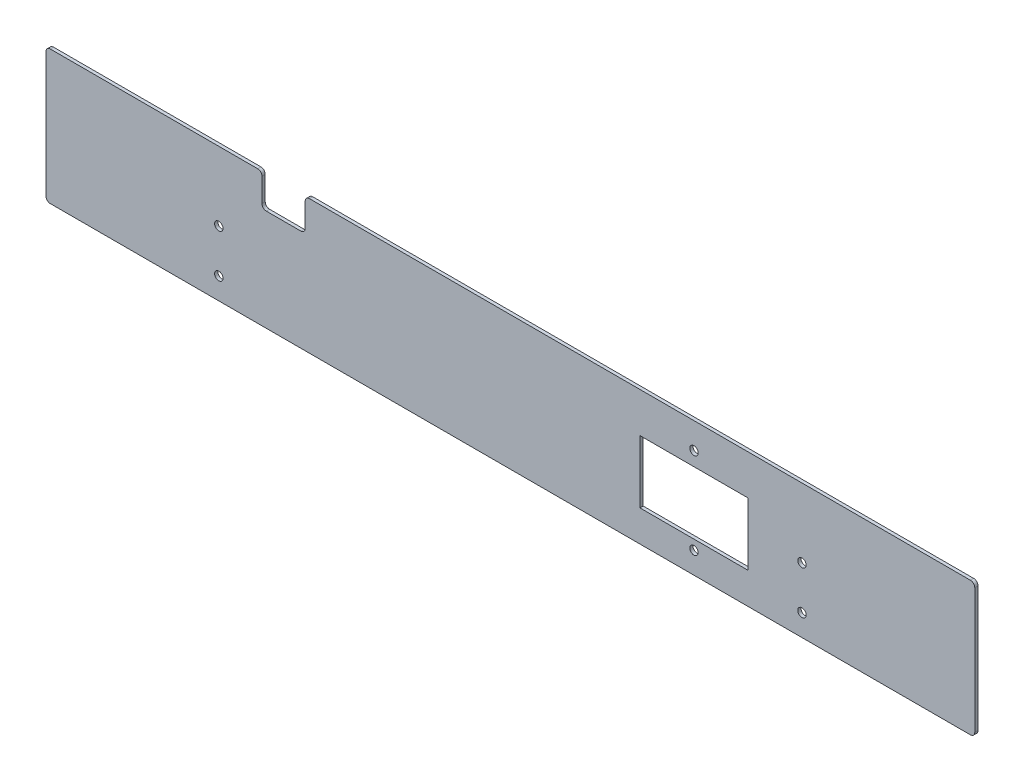
from build123d import *

# Parameters (mm, degrees)
SKETCH1_R           = 1.95
SKETCH1_W           = 50
SKETCH1_H           = 29
BOSS_EXTRUDE1_DEPTH = 1.5
FILLET1_R           = 2
SKETCH3_R           = 1.95
CUT_EXTRUDE1_DEPTH  = 10


with BuildPart() as part:
    # Sketch1 → Boss-Extrude1 (new body)
    with BuildSketch(Plane.XY):
        Polygon((-234.424811832, 29.703517588), (75.575188168, 29.703517588), (75.575188168, -32.296482412), (-354.424811832, -32.296482412), (-354.424811832, 29.703517588), (-254.424811832, 29.703517588), (-254.424811832, 14.703517588), (-234.424811832, 14.703517588), align=None)
        with Locations((-54.424811832, 17.703517588)):
            Circle(SKETCH1_R, mode=Mode.SUBTRACT)
        with Locations((-54.424811832, -22.296482412)):
            Circle(SKETCH1_R, mode=Mode.SUBTRACT)
        with Locations((-54.424811832, -3.296482412)):
            Rectangle(SKETCH1_W, SKETCH1_H, mode=Mode.SUBTRACT)
    extrude(amount=BOSS_EXTRUDE1_DEPTH)

    # Fillet1
    fillet1_edges = [part.edges().sort_by_distance(p)[0] for p in [
        (75.575188168, -32.296482412, 0.75),
        (-354.424811832, -32.296482412, 0.75),
        (-354.424811832, 29.703517588, 0.75),
        (-234.424811832, 14.703517588, 0.75),
        (-254.424811832, 14.703517588, 0.75),
        (-254.424811832, 29.703517588, 0.75),
        (-234.424811832, 29.703517588, 0.75),
        (75.575188168, 29.703517588, 0.75),
    ]]
    fillet(fillet1_edges, radius=FILLET1_R)

    # Sketch3 → Cut-Extrude1 (cut)
    with BuildSketch(Plane(origin=(0, 0, 0), x_dir=(-1, 0, 0), z_dir=(0, 0, -1))):
        with Locations((4.424811832, -22.296482412)):
            Circle(SKETCH3_R)
        with Locations((4.424811832, -2.296482412)):
            Circle(SKETCH3_R)
        with Locations((274.424811832, -22.296482412)):
            Circle(SKETCH3_R)
        with Locations((274.424811832, -2.296482412)):
            Circle(SKETCH3_R)
    extrude(amount=-CUT_EXTRUDE1_DEPTH, mode=Mode.SUBTRACT)


solid = part.part
